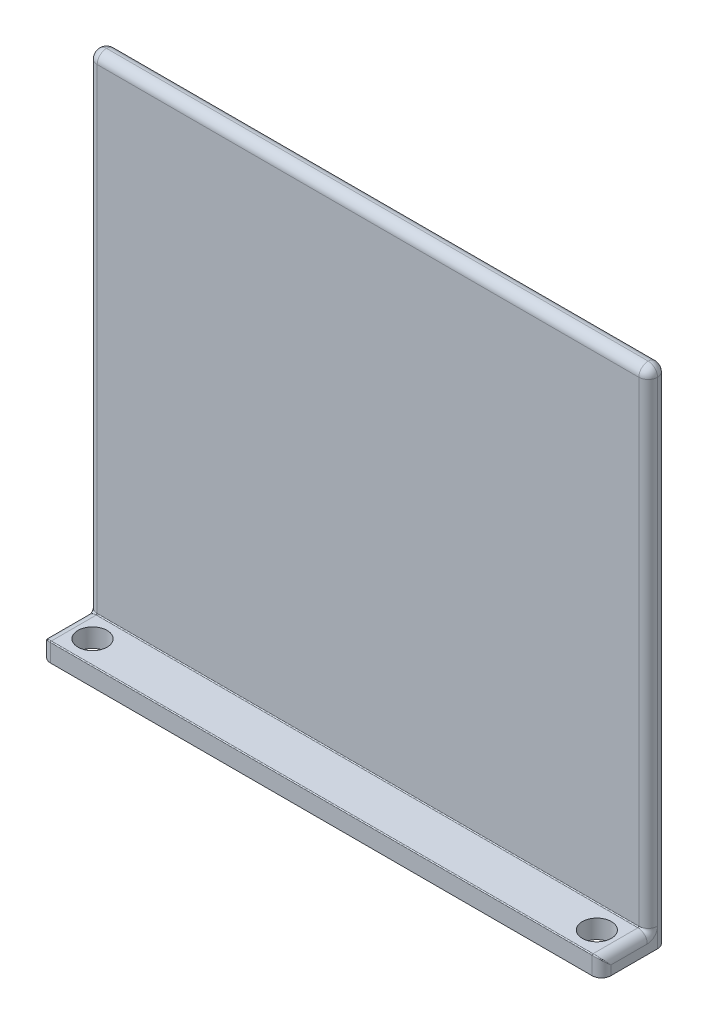
from build123d import *

# Parameters (mm, degrees)
SKETCH1_W           = 60
SKETCH1_H           = 54
BOSS_EXTRUDE1_DEPTH = 2
SKETCH2_W           = 60
SKETCH2_H           = 2
BOSS_EXTRUDE2_DEPTH = 5
SKETCH3_R           = 1.56
CUT_EXTRUDE1_DEPTH  = 5
FILLET1_R           = 0.1
FILLET2_R           = 1
FILLET3_R           = 0.1


with BuildPart() as part:
    # Sketch1 → Boss-Extrude1 (new body)
    with BuildSketch(Plane.XY):
        Rectangle(SKETCH1_W, SKETCH1_H)
    extrude(amount=BOSS_EXTRUDE1_DEPTH)

    # Sketch2 → Boss-Extrude2 (add)
    with BuildSketch(Plane.XY.offset(2)):
        with Locations((0, -26)):
            Rectangle(SKETCH2_W, SKETCH2_H)
    extrude(amount=BOSS_EXTRUDE2_DEPTH)

    # Sketch3 → Cut-Extrude1 (cut)
    with BuildSketch(Plane(origin=(0, -25, 0), x_dir=(1, 0, 0), z_dir=(0, 1, 0))):
        with Locations(Location((27, -4.5, 0), (0, 0, 270))):
            Circle(SKETCH3_R)
        with Locations(Location((-27, -4.5, 0), (0, 0, 270))):
            Circle(SKETCH3_R)
    extrude(amount=-CUT_EXTRUDE1_DEPTH, mode=Mode.SUBTRACT)

    # Fillet1
    fillet1_edges = [part.edges().sort_by_distance(p)[0] for p in [
        (0, -25, 2),
    ]]
    fillet(fillet1_edges, radius=FILLET1_R)

    # Fillet2
    fillet2_edges = [part.edges().sort_by_distance(p)[0] for p in [
        (-30, 1.05, 2),
        (-30, -25, 4.55),
        (30, -25, 4.55),
        (-30, -26, 7),
        (30, -26, 7),
        (30, 1.05, 2),
        (-30, -24.970710678, 2.029289322),
        (30, -24.970710678, 2.029289322),
        (-30, 0, 0),
        (0, 27, 0),
        (30, 0, 0),
        (-30, 27, 1),
        (30, 27, 1),
        (0, 27, 2),
    ]]
    fillet(fillet2_edges, radius=FILLET2_R - 0.0001)  # a hair under: the kernel refuses the full size

    # Fillet3
    fillet3_edges = [part.edges().sort_by_distance(p)[0] for p in [
        (0, -25, 7),
        (-29.763319687, -25.353915697, 6.646084303),
        (29.763319687, -25.353915697, 6.646084303),
    ]]
    fillet(fillet3_edges, radius=FILLET3_R)


solid = part.part
